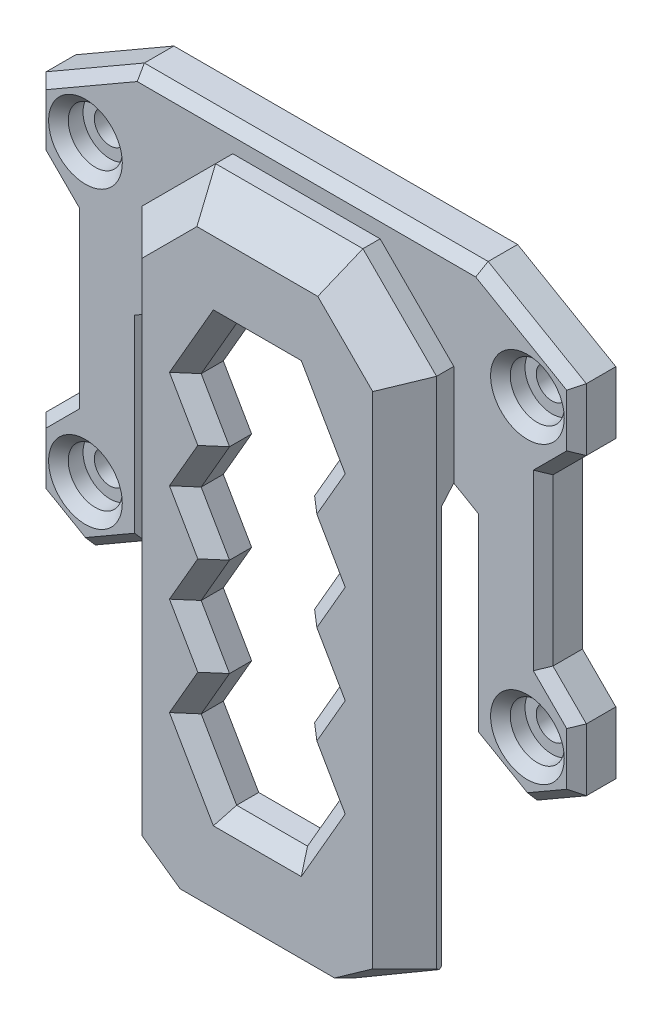
from build123d import *

# Parameters (mm, degrees)
SKETCH1_R           = 1.6
BOSS_EXTRUDE1_DEPTH = 4
SKETCH2_R           = 2.75
CUT_EXTRUDE1_DEPTH  = 2.5
CHAMFER1_SIZE       = 1
BOSS_EXTRUDE2_DEPTH = 5
CHAMFER2_SIZE       = 3.25
BOSS_EXTRUDE3_DEPTH = 52.5
CHAMFER3_SIZE       = 2.75
CUT_EXTRUDE3_DEPTH  = 50
CHAMFER4_SIZE       = 1.5
SKETCH6_W           = 30
SKETCH6_H           = 6
BOSS_EXTRUDE4_DEPTH = 2
CHAMFER5_SIZE       = 2


# Some blends are built 0.0001 mm under size
with BuildPart() as part:
    # Sketch1 → Boss-Extrude1 (new body)
    with BuildSketch(Plane.XY):
        Polygon((17.5, 0), (-17.5, 0), (-27.5, -5.773502692), (-27.5, -12.113248654), (-24.1, -15.513248654), (-24.1, -32.373502692), (-27.5, -35.773502692), (-27.5, -42.113248654), (-22.5, -45), (-17.5, -42.113248654), (-17.5, -20), (-4.509618943, -12.5), (4.509618943, -12.5), (17.5, -20), (17.5, -42.113248654), (22.5, -45), (27.5, -42.113248654), (27.5, -35.773502692), (24.1, -32.373502692), (24.1, -15.513248654), (27.5, -12.113248654), (27.5, -5.773502692), align=None)
        with Locations((-22.5, -8.943375673)):
            Circle(SKETCH1_R, mode=Mode.SUBTRACT)
        with Locations((-22.5, -38.943375673)):
            Circle(SKETCH1_R, mode=Mode.SUBTRACT)
        with Locations(Location((22.5, -38.943375673, 0), (0, 0, 180))):
            Circle(SKETCH1_R, mode=Mode.SUBTRACT)
        with Locations(Location((22.5, -8.943375673, 0), (0, 0, 180))):
            Circle(SKETCH1_R, mode=Mode.SUBTRACT)
    extrude(amount=BOSS_EXTRUDE1_DEPTH)

    # Sketch2 → Cut-Extrude1 (cut)
    with BuildSketch(Plane.XY.offset(4)):
        with Locations((-22.5, -8.943375673)):
            Circle(SKETCH2_R)
        with Locations((22.5, -8.943375673)):
            Circle(SKETCH2_R)
        with Locations((22.5, -38.943375673)):
            Circle(SKETCH2_R)
        with Locations((-22.5, -38.943375673)):
            Circle(SKETCH2_R)
    extrude(amount=-CUT_EXTRUDE1_DEPTH, mode=Mode.SUBTRACT)

    # Chamfer1
    chamfer1_edges = [part.edges().sort_by_distance(p)[0] for p in [
        (-25.8, -13.813248654, 4),
        (-24.1, -23.943375673, 4),
        (-25.8, -34.073502692, 4),
        (-27.5, -38.943375673, 4),
        (-25, -43.556624327, 4),
        (-20, -43.556624327, 4),
        (-22.5, -2.886751346, 4),
        (20, -43.556624327, 4),
        (25, -43.556624327, 4),
        (27.5, -38.943375673, 4),
        (25.8, -34.073502692, 4),
        (24.1, -23.943375673, 4),
        (25.8, -13.813248654, 4),
        (27.5, -8.943375673, 4),
        (22.5, -2.886751346, 4),
        (-25.25, -38.943375673, 4),
        (0, 0, 4),
        (-27.5, -8.943375673, 4),
        (19.75, -38.943375673, 4),
        (19.75, -8.943375673, 4),
        (-25.25, -8.943375673, 4),
    ]]
    chamfer(chamfer1_edges, length=CHAMFER1_SIZE)

    # Sketch3 → Boss-Extrude2 (add)
    with BuildSketch(Plane.XY.offset(4)):
        Polygon((-7.5, -2.5), (7.5, -2.5), (15, -10), (15, -18.556624327), (4.509618943, -12.5), (-4.509618943, -12.5), (-15, -18.556624327), (-15, -10), align=None)
    extrude(amount=BOSS_EXTRUDE2_DEPTH)

    # Chamfer2
    chamfer2_edges = [part.edges().sort_by_distance(p)[0] for p in [
        (-11.25, -6.25, 9),
        (-15, -14.278312164, 9),
        (15, -14.278312164, 9),
        (11.25, -6.25, 9),
        (0, -2.5, 9),
    ]]
    chamfer(chamfer2_edges, length=CHAMFER2_SIZE)

    # Sketch4 → Boss-Extrude3 (add)
    with BuildSketch(Plane.XZ.offset(12.5)):
        Polygon((-11.75, 9), (-15, 5.75), (-15, 5.25), (15, 5.25), (15, 5.75), (11.75, 9), (4.509618943, 9), (-4.509618943, 9), align=None)
    extrude(amount=BOSS_EXTRUDE3_DEPTH)

    # Chamfer3
    # the kernel refuses this chamfer: 2.75 mm, written as the material it adds along each edge
    with BuildSketch(Plane(origin=(-21.124642695, -22.092688435, 5.25), x_dir=(-0.01374793830529312, 0.02381212764408999, -0.9996219169112968), z_dir=(0.8660254037844382, 0.500000000000001, 0))) as chamfer3_piece_1_section:
        Polygon((CHAMFER3_SIZE * 0.999621916911, -CHAMFER3_SIZE * 0.0274958766106), (-CHAMFER3_SIZE * 0.0274958766106, -CHAMFER3_SIZE * 0.999621916911), (0, 0), align=None)
    chamfer3_piece_1 = extrude(amount=26.257505088, mode=Mode.PRIVATE)
    chamfer3_piece_1 = split(chamfer3_piece_1, bisect_by=Plane(origin=(-17.954336586, -20.761071598, 4), z_dir=(0, 0, -1)), keep=Keep.TOP, mode=Mode.PRIVATE)
    chamfer3_piece_1 = split(chamfer3_piece_1, bisect_by=Plane(origin=(-15, -20.761071598, 3.452040033), z_dir=(-1, 0, 0)), keep=Keep.TOP, mode=Mode.PRIVATE)
    add(chamfer3_piece_1)
    with BuildSketch(Plane(origin=(-21.124642695, -22.092688435, 5.25), x_dir=(-0.01374793830529312, 0.02381212764408999, -0.9996219169112968), z_dir=(0.8660254037844382, 0.500000000000001, 0))) as chamfer3_piece_2_section:
        Polygon((CHAMFER3_SIZE * 0.999621916911, -CHAMFER3_SIZE * 0.0274958766106), (-CHAMFER3_SIZE * 0.0274958766106, -CHAMFER3_SIZE * 0.999621916911), (0, 0), align=None)
    chamfer3_piece_2 = extrude(amount=26.257505088, mode=Mode.PRIVATE)
    chamfer3_piece_2 = split(chamfer3_piece_2, bisect_by=Plane(origin=(-9.286470949, -15.798707536, 4), z_dir=(0, 0, -1)), keep=Keep.TOP, mode=Mode.PRIVATE)
    chamfer3_piece_2 = split(chamfer3_piece_2, bisect_by=Plane(origin=(-9.286470949, -12.5, 3.472082551), z_dir=(0, -1, 0)), keep=Keep.TOP, mode=Mode.PRIVATE)
    chamfer3_piece_2 = split(chamfer3_piece_2, bisect_by=Plane(origin=(-15, -15.798707536, 3.472082551), z_dir=(1, 0, 0)), keep=Keep.TOP, mode=Mode.PRIVATE)
    add(chamfer3_piece_2)
    with BuildSketch(Plane(origin=(-21.124642695, -22.092688435, 5.25), x_dir=(-0.01374793830529312, 0.02381212764408999, -0.9996219169112968), z_dir=(0.8660254037844382, 0.500000000000001, 0))) as chamfer3_piece_3_section:
        Polygon((CHAMFER3_SIZE * 0.999621916911, -CHAMFER3_SIZE * 0.0274958766106), (-CHAMFER3_SIZE * 0.0274958766106, -CHAMFER3_SIZE * 0.999621916911), (0, 0), align=None)
    chamfer3_piece_3 = extrude(amount=26.257505088, mode=Mode.PRIVATE)
    chamfer3_piece_3 = split(chamfer3_piece_3, bisect_by=Plane(origin=(-8.570164938, -16.212267004, 4), z_dir=(0, 0, 1)), keep=Keep.TOP, mode=Mode.PRIVATE)
    chamfer3_piece_3 = split(chamfer3_piece_3, bisect_by=Plane(origin=(-8.570164938, -12.5, 4.737501352), z_dir=(0, -1, 0)), keep=Keep.TOP, mode=Mode.PRIVATE)
    chamfer3_piece_3 = split(chamfer3_piece_3, bisect_by=Plane(origin=(-15, -16.212267004, 4.737501352), z_dir=(1, 0, 0)), keep=Keep.TOP, mode=Mode.PRIVATE)
    add(chamfer3_piece_3)
    with BuildSketch(Plane(origin=(-21.124642695, -22.092688435, 5.25), x_dir=(-0.01374793830529312, 0.02381212764408999, -0.9996219169112968), z_dir=(0.8660254037844382, 0.500000000000001, 0))) as chamfer3_piece_4_section:
        Polygon((CHAMFER3_SIZE * 0.999621916911, -CHAMFER3_SIZE * 0.0274958766106), (-CHAMFER3_SIZE * 0.0274958766106, -CHAMFER3_SIZE * 0.999621916911), (0, 0), align=None)
    chamfer3_piece_4 = extrude(amount=26.257505088, mode=Mode.PRIVATE)
    chamfer3_piece_4 = split(chamfer3_piece_4, bisect_by=Plane(origin=(-0.9405737, -10.907502252, 4), z_dir=(0, 0, -1)), keep=Keep.TOP, mode=Mode.PRIVATE)
    chamfer3_piece_4 = split(chamfer3_piece_4, bisect_by=Plane(origin=(-0.9405737, -12.5, 3.437415432), z_dir=(0, 1, 0)), keep=Keep.TOP, mode=Mode.PRIVATE)
    add(chamfer3_piece_4)
    with BuildSketch(Plane(origin=(-21.124642695, -22.092688435, 5.25), x_dir=(-0.01374793830529312, 0.02381212764408999, -0.9996219169112968), z_dir=(0.8660254037844382, 0.500000000000001, 0))) as chamfer3_piece_5_section:
        Polygon((CHAMFER3_SIZE * 0.999621916911, -CHAMFER3_SIZE * 0.0274958766106), (-CHAMFER3_SIZE * 0.0274958766106, -CHAMFER3_SIZE * 0.999621916911), (0, 0), align=None)
    chamfer3_piece_5 = extrude(amount=26.257505088, mode=Mode.PRIVATE)
    chamfer3_piece_5 = split(chamfer3_piece_5, bisect_by=Plane(origin=(-0.271585023, -11.139246728, 4), z_dir=(0, 0, 1)), keep=Keep.TOP, mode=Mode.PRIVATE)
    chamfer3_piece_5 = split(chamfer3_piece_5, bisect_by=Plane(origin=(-0.271585023, -12.5, 4.697391436), z_dir=(0, 1, 0)), keep=Keep.TOP, mode=Mode.PRIVATE)
    add(chamfer3_piece_5)
    with BuildSketch(Plane(origin=(-1.615023751, -8.963935892, 5.25), x_dir=(0.013747938305293148, 0.023812127644090013, -0.9996219169112968), z_dir=(0.8660254037844379, -0.5000000000000013, 0))) as chamfer3_piece_6_section:
        Polygon((CHAMFER3_SIZE * 0.999621916911, -CHAMFER3_SIZE * 0.0274958766106), (-CHAMFER3_SIZE * 0.0274958766106, -CHAMFER3_SIZE * 0.999621916911), (0, 0), align=None)
    chamfer3_piece_6 = extrude(amount=26.257505088, mode=Mode.PRIVATE)
    chamfer3_piece_6 = split(chamfer3_piece_6, bisect_by=Plane(origin=(0.9405737, -12.5, 3.437415432), z_dir=(0, 1, 0)), keep=Keep.TOP, mode=Mode.PRIVATE)
    chamfer3_piece_6 = split(chamfer3_piece_6, bisect_by=Plane(origin=(0.9405737, -10.907502252, 4), z_dir=(0, 0, -1)), keep=Keep.TOP, mode=Mode.PRIVATE)
    add(chamfer3_piece_6)
    with BuildSketch(Plane(origin=(-1.615023751, -8.963935892, 5.25), x_dir=(0.013747938305293148, 0.023812127644090013, -0.9996219169112968), z_dir=(0.8660254037844379, -0.5000000000000013, 0))) as chamfer3_piece_7_section:
        Polygon((CHAMFER3_SIZE * 0.999621916911, -CHAMFER3_SIZE * 0.0274958766106), (-CHAMFER3_SIZE * 0.0274958766106, -CHAMFER3_SIZE * 0.999621916911), (0, 0), align=None)
    chamfer3_piece_7 = extrude(amount=26.257505088, mode=Mode.PRIVATE)
    chamfer3_piece_7 = split(chamfer3_piece_7, bisect_by=Plane(origin=(0.271585023, -12.5, 4.697391436), z_dir=(0, 1, 0)), keep=Keep.TOP, mode=Mode.PRIVATE)
    chamfer3_piece_7 = split(chamfer3_piece_7, bisect_by=Plane(origin=(0.271585023, -11.139246728, 4), z_dir=(0, 0, 1)), keep=Keep.TOP, mode=Mode.PRIVATE)
    add(chamfer3_piece_7)
    with BuildSketch(Plane(origin=(-1.615023751, -8.963935892, 5.25), x_dir=(0.013747938305293148, 0.023812127644090013, -0.9996219169112968), z_dir=(0.8660254037844379, -0.5000000000000013, 0))) as chamfer3_piece_8_section:
        Polygon((CHAMFER3_SIZE * 0.999621916911, -CHAMFER3_SIZE * 0.0274958766106), (-CHAMFER3_SIZE * 0.0274958766106, -CHAMFER3_SIZE * 0.999621916911), (0, 0), align=None)
    chamfer3_piece_8 = extrude(amount=26.257505088, mode=Mode.PRIVATE)
    chamfer3_piece_8 = split(chamfer3_piece_8, bisect_by=Plane(origin=(15, -15.798707536, 3.472082551), z_dir=(-1, 0, 0)), keep=Keep.TOP, mode=Mode.PRIVATE)
    chamfer3_piece_8 = split(chamfer3_piece_8, bisect_by=Plane(origin=(9.286470949, -12.5, 3.472082551), z_dir=(0, -1, 0)), keep=Keep.TOP, mode=Mode.PRIVATE)
    chamfer3_piece_8 = split(chamfer3_piece_8, bisect_by=Plane(origin=(9.286470949, -15.798707536, 4), z_dir=(0, 0, -1)), keep=Keep.TOP, mode=Mode.PRIVATE)
    add(chamfer3_piece_8)
    with BuildSketch(Plane(origin=(-1.615023751, -8.963935892, 5.25), x_dir=(0.013747938305293148, 0.023812127644090013, -0.9996219169112968), z_dir=(0.8660254037844379, -0.5000000000000013, 0))) as chamfer3_piece_9_section:
        Polygon((CHAMFER3_SIZE * 0.999621916911, -CHAMFER3_SIZE * 0.0274958766106), (-CHAMFER3_SIZE * 0.0274958766106, -CHAMFER3_SIZE * 0.999621916911), (0, 0), align=None)
    chamfer3_piece_9 = extrude(amount=26.257505088, mode=Mode.PRIVATE)
    chamfer3_piece_9 = split(chamfer3_piece_9, bisect_by=Plane(origin=(15, -16.212267004, 4.737501352), z_dir=(-1, 0, 0)), keep=Keep.TOP, mode=Mode.PRIVATE)
    chamfer3_piece_9 = split(chamfer3_piece_9, bisect_by=Plane(origin=(8.570164938, -12.5, 4.737501352), z_dir=(0, -1, 0)), keep=Keep.TOP, mode=Mode.PRIVATE)
    chamfer3_piece_9 = split(chamfer3_piece_9, bisect_by=Plane(origin=(8.570164938, -16.212267004, 4), z_dir=(0, 0, 1)), keep=Keep.TOP, mode=Mode.PRIVATE)
    add(chamfer3_piece_9)
    with BuildSketch(Plane(origin=(-1.615023751, -8.963935892, 5.25), x_dir=(0.013747938305293148, 0.023812127644090013, -0.9996219169112968), z_dir=(0.8660254037844379, -0.5000000000000013, 0))) as chamfer3_piece_10_section:
        Polygon((CHAMFER3_SIZE * 0.999621916911, -CHAMFER3_SIZE * 0.0274958766106), (-CHAMFER3_SIZE * 0.0274958766106, -CHAMFER3_SIZE * 0.999621916911), (0, 0), align=None)
    chamfer3_piece_10 = extrude(amount=26.257505088, mode=Mode.PRIVATE)
    chamfer3_piece_10 = split(chamfer3_piece_10, bisect_by=Plane(origin=(15, -20.761071598, 3.452040033), z_dir=(1, 0, 0)), keep=Keep.TOP, mode=Mode.PRIVATE)
    chamfer3_piece_10 = split(chamfer3_piece_10, bisect_by=Plane(origin=(17.954336586, -20.761071598, 4), z_dir=(0, 0, -1)), keep=Keep.TOP, mode=Mode.PRIVATE)
    add(chamfer3_piece_10)
    with BuildSketch(Plane(origin=(-11.58174716, -12.5, 5.25), x_dir=(0, -0.9996219169112968, 0.02749587661058625), z_dir=(1, 0, 0))) as chamfer3_piece_11:
        Polygon((CHAMFER3_SIZE * 0.999621916911, CHAMFER3_SIZE * 0.0274958766106), (-CHAMFER3_SIZE * 0.0274958766106, CHAMFER3_SIZE * 0.999621916911), (0, 0), align=None)
    extrude(amount=23.16349432)
    # the kernel refuses this chamfer: 2.75 mm, written as the material it takes off along each edge
    with BuildSketch(Plane(origin=(20.00074982, -65, 0.74925018), x_dir=(0.019442520806014035, 0.9996219169112968, 0.019442520806013917), z_dir=(-0.7071067811865454, 0, 0.7071067811865497))) as chamfer3_2_piece_1:
        Polygon((CHAMFER3_SIZE * 0.999621916911, CHAMFER3_SIZE * 0.0274958766106), (-CHAMFER3_SIZE * 0.0274958766106, CHAMFER3_SIZE * 0.999621916911), (0, 0), align=None)
    extrude(amount=18.740450512, mode=Mode.SUBTRACT)
    with BuildSketch(Plane(origin=(-22.072128217, -65, 5.25), x_dir=(0, -0.027495876610587187, 0.9996219169112966), z_dir=(1, 0, 0))) as chamfer3_2_piece_2:
        Polygon((CHAMFER3_SIZE * 0.999621916911, -CHAMFER3_SIZE * 0.0274958766106), (-CHAMFER3_SIZE * 0.0274958766106, -CHAMFER3_SIZE * 0.999621916911), (0, 0), align=None)
    extrude(amount=44.144256434, mode=Mode.SUBTRACT)
    with BuildSketch(Plane(origin=(-6.74925018, -65, 14.00074982), x_dir=(0.7068394360706757, -0.027495876610587198, -0.7068394360706712), z_dir=(-0.7071067811865454, 0, -0.7071067811865497))) as chamfer3_2_piece_3:
        Polygon((CHAMFER3_SIZE * 0.999621916911, -CHAMFER3_SIZE * 0.0274958766106), (-CHAMFER3_SIZE * 0.0274958766106, -CHAMFER3_SIZE * 0.999621916911), (0, 0), align=None)
    extrude(amount=18.740450512, mode=Mode.SUBTRACT)

    # Sketch5 → Cut-Extrude3 (cut)
    with BuildSketch(Plane.XY.offset(9)):
        Polygon((7.216878365, -30), (3.608439182, -23.75), (-3.608439182, -23.75), (-7.216878365, -30), (-3.608439182, -36.25), (3.608439182, -36.25), align=None)
        Polygon((7.216878365, -20), (3.608439182, -13.75), (-3.608439182, -13.75), (-7.216878365, -20), (-3.608439182, -26.25), (3.608439182, -26.25), align=None)
        Polygon((7.216878365, -40), (3.608439182, -33.75), (-3.608439182, -33.75), (-7.216878365, -40), (-3.608439182, -46.25), (3.608439182, -46.25), align=None)
        Polygon((7.216878365, -50), (3.608439182, -43.75), (-3.608439182, -43.75), (-7.216878365, -50), (-3.608439182, -56.25), (3.608439182, -56.25), align=None)
    extrude(amount=-CUT_EXTRUDE3_DEPTH, mode=Mode.SUBTRACT)

    # Chamfer4
    chamfer4_edges = [part.edges().sort_by_distance(p)[0] for p in [
        (5.773502692, -47.5, 9),
        (5.773502692, -42.5, 9),
        (5.773502692, -37.5, 9),
        (5.773502692, -32.5, 9),
        (5.773502692, -27.5, 9),
        (5.773502692, -22.5, 9),
        (5.412658774, -16.875, 9),
        (0, -13.75, 9),
        (-5.412658774, -16.875, 9),
        (-5.773502692, -22.5, 9),
        (-5.773502692, -27.5, 9),
        (-5.773502692, -32.5, 9),
        (-5.773502692, -37.5, 9),
        (-5.773502692, -42.5, 9),
        (-5.773502692, -47.5, 9),
        (-5.412658774, -53.125, 9),
        (0, -56.25, 9),
        (5.412658774, -53.125, 9),
    ]]
    chamfer(chamfer4_edges, length=CHAMFER4_SIZE)

    # Sketch6 → Boss-Extrude4 (add)
    with BuildSketch(Plane(origin=(0, 0, 5.25), x_dir=(-1, 0, 0), z_dir=(0, 0, -1))):
        with Locations((0, -59.25)):
            Rectangle(SKETCH6_W, SKETCH6_H)
    extrude(amount=BOSS_EXTRUDE4_DEPTH)

    # Chamfer5
    chamfer5_edges = [part.edges().sort_by_distance(p)[0] for p in [
        (0, -56.25, 3.25),
        (-15, -59.25, 3.25),
        (0, -62.25, 3.25),
        (15, -59.25, 3.25),
    ]]
    chamfer(chamfer5_edges, length=CHAMFER5_SIZE - 0.0001)  # a hair under: the kernel refuses the full size


solid = part.part
